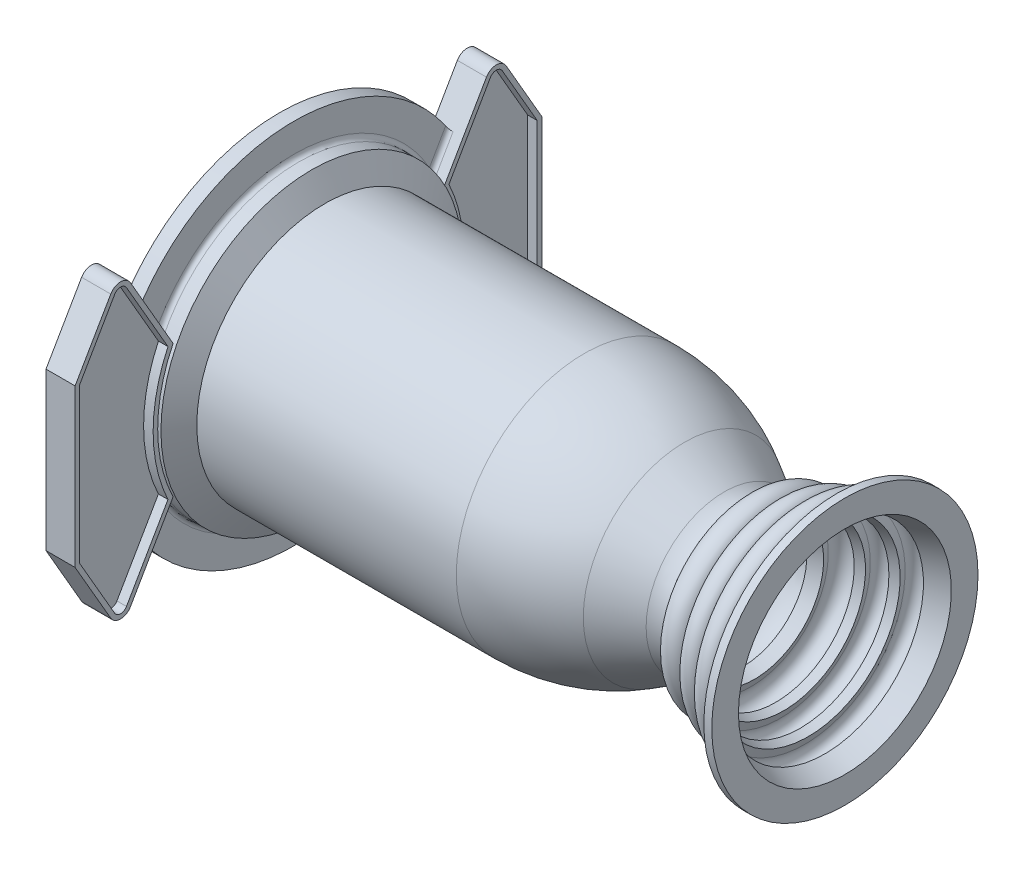
from build123d import *
from build123d.topology import SkipClean

# Parameters (mm, degrees)
BOSS_EXTRUDE1_DEPTH     = 16.256
CUT_EXTRUDE1_DEPTH      = 5.334
BOSS_EXTRUDE2_START     = -8.128
BOSS_EXTRUDE2_DEPTH     = 8.128
FILLET2_R               = 2.54
CUT_EXTRUDE4_DEPTH      = 404.084600433
CUT_EXTRUDE4_DEPTH_BACK = 404.084600433
SKETCH17_W              = 85
SKETCH17_H              = 190


with BuildPart() as part:
    # Sketch3 → Revolve1 (revolve)
    with BuildSketch(Plane.XY):
        with BuildLine():
            Line((0, 71.5011717), (144.934666475, 71.5011717))
            ThreePointArc((144.934666475, 71.5011717), (173.892574508, 67.688769671), (200.877042723, 56.51141211))
            Line((200.877042723, 56.51141211), (223.127154881, 43.665279514))
            ThreePointArc((223.127154881, 43.665279514), (227.625034583, 41.721337074), (232.448772375, 40.860298318))
            add(Edge.make_bspline(
                [(232.448772375, 40.860298318), (234.86856203, 41.933657894), (240.173238318, 44.266655644), (251.176182965, 49.013937562), (265.440009786, 54.97345202), (282.448229164, 61.765962568), (299.354503113, 68.202057856), (316.156963457, 74.280596731), (332.857651733, 80.001884245), (346.685594207, 84.470267584), (357.704525634, 87.868146407), (363.182392167, 89.503083437), (365.9308663, 90.309661005)],
                knots=[0.492875979, 0.492875979, 0.492875979, 0.492875979, 0.492966882, 0.493074775, 0.493290561, 0.493506346, 0.493722132, 0.493937918, 0.494153704, 0.494369489, 0.494477382, 0.494585275, 0.494585275, 0.494585275, 0.494585275], degree=3))
            Line((365.9308663, 90.309661005), (367.338810321, 85.511985147))
            add(Edge.make_bspline(
                [(233.424633311, 35.822756061), (236.183141196, 37.049408729), (241.820242455, 39.531718175), (253.12775411, 44.410404122), (267.331680592, 50.344882311), (284.265598042, 57.10770533), (301.095145103, 63.51457761), (317.818383555, 69.564442688), (334.43732724, 75.257710839), (348.19495997, 79.703362784), (359.156425704, 83.083517043), (364.604957844, 84.709698506), (367.338810321, 85.511985147)],
                knots=[0.492862754, 0.492862754, 0.492862754, 0.492862754, 0.492966882, 0.493074775, 0.493290561, 0.493506346, 0.493722132, 0.493937918, 0.494153704, 0.494369489, 0.494477382, 0.494585275, 0.494585275, 0.494585275, 0.494585275], degree=3))
            ThreePointArc((233.424633311, 35.822756061), (226.800103593, 36.756276843), (220.627157517, 39.335150973))
            Line((220.627157517, 39.335150973), (198.377039169, 52.181287144))
            ThreePointArc((198.377039169, 52.181287144), (172.598474463, 62.859141831), (144.9346606, 66.5011717))
            Line((144.9346606, 66.5011717), (0, 66.5011717))
            Line((0, 66.5011717), (0, 71.5011717))
        make_face()
    revolve(axis=Axis((0, 0, 0), (1, 0, 0)))

    # Sketch4 → Revolve5 (revolve)
    with BuildSketch(Plane.XY):
        Polygon((-25.4, 66.5011717), (-25.4, 84.2011717), (-7.332348419, 84.2011717), (0, 71.5011717), (0, 66.5011717), align=None)
    revolve(axis=Axis((0, 0, 0), (1, 0, 0)))

    # Sketch6 → Boss-Extrude1 (add)
    with SkipClean():  # the faces are left unmerged after this step: merging them gives an invalid solid
        with BuildSketch(Plane.ZY.offset(25.4)):
            with BuildLine():
                Line((64.197098299, 17.35333995), (99.428641487, 78.37616278))
                ThreePointArc((99.428641487, 78.37616278), (104.927902801, 81.55116278), (110.427164115, 78.37616278))
                Line((110.427164115, 78.37616278), (130.327902801, 43.907072268))
                Line((130.327902801, 43.907072268), (130.327902801, -43.907072268))
                Line((130.327902801, -43.907072268), (110.427164115, -78.37616278))
                ThreePointArc((110.427164115, -78.37616278), (104.927902801, -81.55116278), (99.428641487, -78.37616278))
                Line((99.428641487, -78.37616278), (64.197098299, -17.35333995))
                ThreePointArc((64.197098299, -17.35333995), (66.5011717, 0), (64.197098299, 17.35333995))
            make_face()
            with BuildLine():
                Line((-64.197098299, -17.35333995), (-99.428641487, -78.37616278))
                ThreePointArc((-99.428641487, -78.37616278), (-104.927902801, -81.55116278), (-110.427164115, -78.37616278))
                Line((-110.427164115, -78.37616278), (-130.327902801, -43.907072268))
                Line((-130.327902801, -43.907072268), (-130.327902801, 43.907072268))
                Line((-130.327902801, 43.907072268), (-110.427164115, 78.37616278))
                ThreePointArc((-110.427164115, 78.37616278), (-104.927902801, 81.55116278), (-99.428641487, 78.37616278))
                Line((-99.428641487, 78.37616278), (-64.197098299, 17.35333995))
                ThreePointArc((-64.197098299, 17.35333995), (-66.5011717, 0), (-64.197098299, -17.35333995))
            make_face()
        extrude(amount=-BOSS_EXTRUDE1_DEPTH)

    # Sketch7 → Cut-Extrude1 (cut)
    with SkipClean():  # the faces are left unmerged after this step: merging them gives an invalid solid
        with BuildSketch(Plane(origin=(-9.144, 0, 0), x_dir=(0, 0, -1), z_dir=(1, 0, 0))):
            with BuildLine():
                Line((-78.462562562, 36.981848846), (-101.628346013, 77.10616278))
                ThreePointArc((-101.628346013, 77.10616278), (-104.927902801, 79.01116278), (-108.22745959, 77.10616278))
                Line((-108.22745959, 77.10616278), (-127.787902801, 43.226481319))
                Line((-127.787902801, 43.226481319), (-127.787902801, -43.226481319))
                Line((-127.787902801, -43.226481319), (-108.22745959, -77.10616278))
                ThreePointArc((-108.22745959, -77.10616278), (-104.927902801, -79.01116278), (-101.628346013, -77.10616278))
                Line((-101.628346013, -77.10616278), (-78.462562562, -36.981848846))
                ThreePointArc((-78.462562562, -36.981848846), (-86.7411717, 0), (-78.462562562, 36.981848846))
            make_face()
            with BuildLine():
                Line((101.628346013, -77.10616278), (78.462562562, -36.981848846))
                ThreePointArc((78.462562562, -36.981848846), (86.7411717, 0), (78.462562562, 36.981848846))
                Line((78.462562562, 36.981848846), (101.628346013, 77.10616278))
                ThreePointArc((101.628346013, 77.10616278), (104.927902801, 79.01116278), (108.22745959, 77.10616278))
                Line((108.22745959, 77.10616278), (127.787902801, 43.226481319))
                Line((127.787902801, 43.226481319), (127.787902801, -43.226481319))
                Line((127.787902801, -43.226481319), (108.22745959, -77.10616278))
                ThreePointArc((108.22745959, -77.10616278), (104.927902801, -79.01116278), (101.628346013, -77.10616278))
            make_face()
        extrude(amount=-CUT_EXTRUDE1_DEPTH, mode=Mode.SUBTRACT)

    # Sketch8 → Boss-Extrude2 (add)
    with SkipClean():  # the faces are left unmerged after this step: merging them gives an invalid solid
        with BuildSketch(Plane.ZY.offset(25.4).offset(BOSS_EXTRUDE2_START)):
            with BuildLine():
                Line((-75.592096587, 37.090055935), (-86.329826389, 55.688349511))
                ThreePointArc((-86.329826389, 55.688349511), (0, 102.7328146), (86.329826389, 55.688349511))
                Line((86.329826389, 55.688349511), (75.592096587, 37.090055935))
                ThreePointArc((75.592096587, 37.090055935), (0, 84.2011717), (-75.592096587, 37.090055935))
            make_face()
            with BuildLine():
                Line((86.329826389, -55.688349511), (75.592096587, -37.090055935))
                ThreePointArc((75.592096587, -37.090055935), (0, -84.2011717), (-75.592096587, -37.090055935))
                Line((-75.592096587, -37.090055935), (-86.329826389, -55.688349511))
                ThreePointArc((-86.329826389, -55.688349511), (0, -102.7328146), (86.329826389, -55.688349511))
            make_face()
        extrude(amount=BOSS_EXTRUDE2_DEPTH)

    # Fillet2
    fillet2_edges = [part.edges().sort_by_distance(p)[0] for p in [
        (-17.272, 46.389202723, 80.960961488),
        (-17.272, 71.459301297, 44.535441771),
        (-17.272, 46.389202723, -80.960961488),
        (-17.272, -46.389202723, -80.960961488),
        (-17.272, -84.2011717, 0),
        (-17.272, -46.389202723, 80.960961488),
    ]]
    fillet(fillet2_edges, radius=FILLET2_R)

    # Sketch17 → Cut-Extrude4 (cut, two sides: drawn at the far end of the back side and taken through both)
    with SkipClean():  # the faces are left unmerged after this step: merging them gives an invalid solid
        with BuildSketch(Plane.XY.offset(-CUT_EXTRUDE4_DEPTH_BACK)):
            with Locations((332.986, 0)):
                Rectangle(SKETCH17_W, SKETCH17_H)
        extrude(amount=CUT_EXTRUDE4_DEPTH + CUT_EXTRUDE4_DEPTH_BACK, mode=Mode.SUBTRACT)

    # Sketch18 → Revolve7 (revolve)
    with SkipClean():  # the faces are left unmerged after this step: merging them gives an invalid solid
        with BuildSketch(Plane.XY):
            with BuildLine():
                Line((290.486, 64.812548202), (290.486, 74.344558602))
                Line((290.486, 74.344558602), (286.041, 74.344558602))
                Line((286.041, 74.344558602), (286.041, 63.107390563))
                add(Edge.make_bspline(
                    [(290.486, 64.812548202), (289.005513956, 64.248266071), (287.523845347, 63.679879019), (286.041, 63.107390563)],
                    knots=[0.493835272, 0.493835272, 0.493835272, 0.493835272, 0.493891953, 0.493891953, 0.493891953, 0.493891953], degree=3))
            make_face()
        revolve(axis=Axis((0, 0, 0), (1, 0, 0)))

    # Sketch13 → Revolve6 (revolve)
    with SkipClean():  # the faces are left unmerged after this step: merging them gives an invalid solid
        with BuildSketch(Plane.XY):
            with BuildLine():
                Line((253.452894778, 49.926348503), (264.534326054, 54.53089852))
                ThreePointArc((264.534326054, 54.53089852), (256.691335407, 57.76933915), (253.452894778, 49.926348503))
            make_face()
            with BuildLine():
                Line((237.023320854, 42.878591235), (250.795528896, 48.822161344))
                ThreePointArc((250.795528896, 48.822161344), (240.940832573, 52.729082189), (237.023320854, 42.878591235))
            make_face()
            with BuildLine():
                Line((267.198650557, 55.637915731), (278.337884608, 60.100704118))
                ThreePointArc((278.337884608, 60.100704118), (270.531031028, 63.453509633), (267.198650557, 55.637915731))
            make_face()
        revolve(axis=Axis((0, 0, 0), (1, 0, 0)))

    # Sketch19 → Cut-Revolve1 (revolve, cut)
    with SkipClean():  # the faces are left unmerged after this step: merging them gives an invalid solid
        with BuildSketch(Plane.XY):
            with BuildLine():
                Line((237.945873974, 43.276730671), (239.927065155, 38.685992005))
                Line((239.927065155, 38.685992005), (251.858568202, 43.835182654))
                Line((251.858568202, 43.835182654), (249.877377021, 48.42592132))
                ThreePointArc((249.877377021, 48.42592132), (241.337030173, 51.817077519), (237.945873974, 43.276730671))
            make_face()
            with BuildLine():
                Line((254.369462652, 50.326700303), (256.288085496, 45.709462343))
                Line((256.288085496, 45.709462343), (265.522511147, 49.546687142))
                Line((265.522511147, 49.546687142), (263.603888303, 54.163925102))
                ThreePointArc((263.603888303, 54.163925102), (257.068063078, 56.862525528), (254.369462652, 50.326700303))
            make_face()
            with BuildLine():
                Line((268.126923235, 56.009816035), (270.150419973, 50.95911638))
                Line((270.150419973, 50.95911638), (279.433108668, 54.67810416))
                Line((279.433108668, 54.67810416), (277.40961193, 59.728803815))
                ThreePointArc((277.40961193, 59.728803815), (270.908773693, 62.510654272), (268.126923235, 56.009816035))
            make_face()
        revolve(axis=Axis((0, 0, 0), (1, 0, 0)), mode=Mode.SUBTRACT)


solid = part.part
